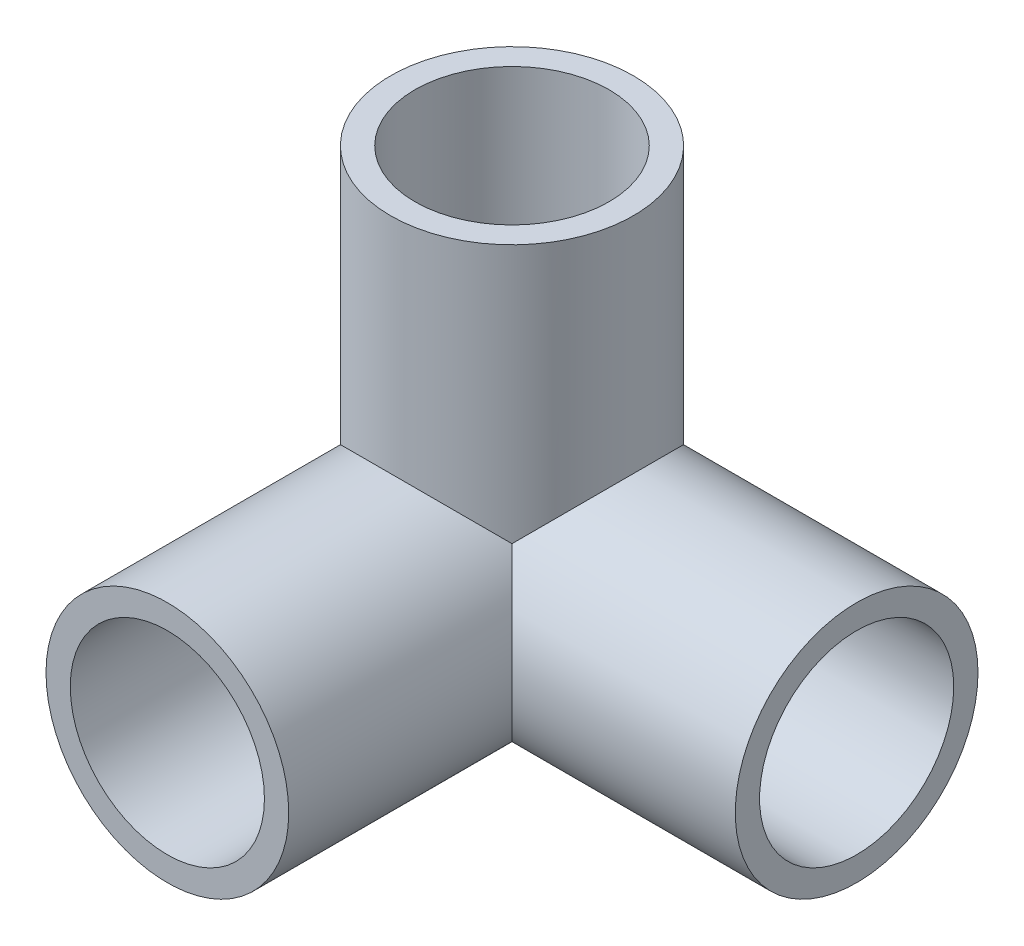
from build123d import *
from build123d.topology import SkipClean

# Parameters (mm, degrees)
SKETCH_2_R      = 10
EXTRUDE_1_DEPTH = 35.5
SKETCH_3_R      = 10
EXTRUDE_2_DEPTH = 35.5
SKETCH_4_R      = 10
EXTRUDE_3_DEPTH = 35.5
SHELL_1_T       = 2.5


with BuildPart() as part:
    # 草图1 → 旋转1 (revolve)
    with BuildSketch(Plane.XY):
        with BuildLine():
            Line((0, 10), (0, -10))
            ThreePointArc((0, -10), (7.071067812, -7.071067812), (10, 0))
            ThreePointArc((10, 0), (7.071067812, 7.071067812), (0, 10))
        make_face()
    revolve(axis=Axis((0, -1000, 0), (0, 1, 0)))

    # 草图2 → 凸台-拉伸1 (add)
    with SkipClean():  # the faces are left unmerged after this step: merging them gives an invalid solid
        with BuildSketch(Plane.XY):
            Circle(SKETCH_2_R)
        extrude(amount=EXTRUDE_1_DEPTH)

    # 草图3 → 凸台-拉伸2 (add)
    with BuildSketch(Plane(origin=(0, 0, 0), x_dir=(1, 0, 0), z_dir=(0, 1, 0))):
        Circle(SKETCH_3_R)
    extrude(amount=EXTRUDE_2_DEPTH)

    # 草图4 → 凸台-拉伸3 (add)
    with BuildSketch(Plane(origin=(0, 0, 0), x_dir=(0, 0, -1), z_dir=(1, 0, 0))):
        Circle(SKETCH_4_R)
    extrude(amount=EXTRUDE_3_DEPTH)

    # 抽壳1
    shell_1_openings = [part.faces().sort_by_distance(p)[0] for p in [
        (0, 0, 35.5),
        (0, 35.5, 0),
        (35.5, 0, 0),
    ]]
    offset(amount=SHELL_1_T, openings=shell_1_openings)


solid = part.part
